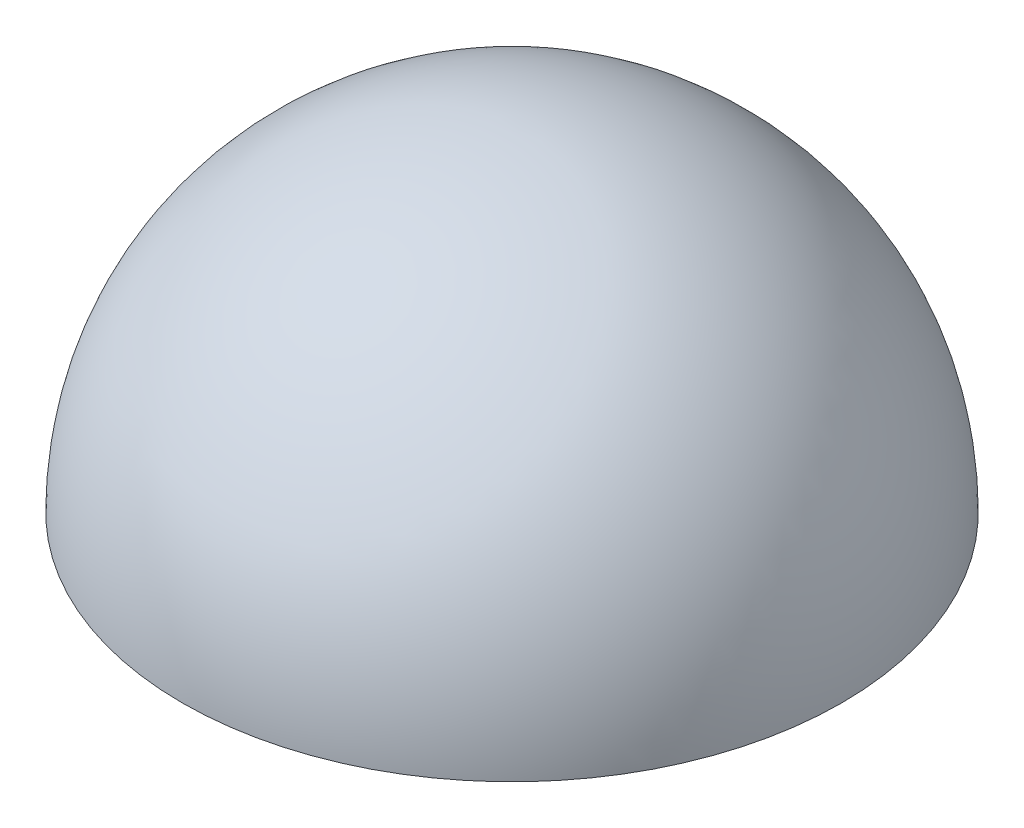
from build123d import *


with BuildPart() as part:
    # Sketch1 → Revolve1 (revolve)
    with BuildSketch(Plane.XY):
        with BuildLine():
            Line((-12.7, 0), (0, 0))
            Line((0, 0), (0, 0.05189907))
            Line((0, 0.05189907), (0, 12.7))
            ThreePointArc((0, 12.7), (-8.980256121, 8.980256121), (-12.7, 0))
        make_face()
    revolve(axis=Axis((0, 0, 0), (0, 1, 0)))


solid = part.part
